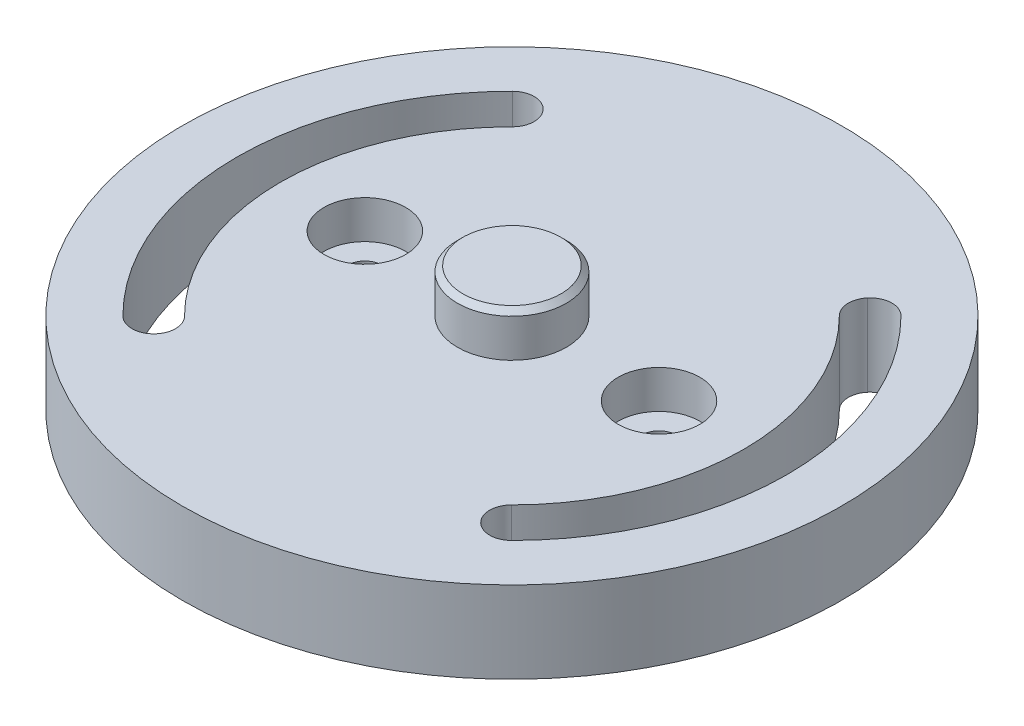
from build123d import *

# Parameters (mm, degrees)
SKETCH1_R           = 60.5
SKETCH1_R_2         = 50.5
SKETCH1_R_3         = 42.5
BOSS_EXTRUDE1_DEPTH = 15
SKETCH2_R           = 7.5
CUT_EXTRUDE1_DEPTH  = 7
SKETCH3_R           = 3.15
CUT_EXTRUDE2_DEPTH  = 15
FILLET1_R           = 4
SKETCH4_R           = 10
BOSS_EXTRUDE2_DEPTH = 8
CHAMFER1_SIZE       = 1


with BuildPart() as part:
    # Sketch1 → Boss-Extrude1 (new body)
    # profile 1 of 4: a face of its own
    with BuildSketch(Plane(origin=(0, 0, 0), x_dir=(1, 0, 0), z_dir=(0, 1, 0))):
        with Locations(Location((0, 0, 0), (0, 0, 270))):
            Circle(SKETCH1_R)
        Circle(SKETCH1_R_2, mode=Mode.SUBTRACT)
    # profile 2 of 4: a face of its own
    with BuildSketch(Plane(origin=(0, 0, 0), x_dir=(1, 0, 0), z_dir=(0, 1, 0))):
        with BuildLine():
            ThreePointArc((-27.318473412, 32.556888833), (0, 42.5), (27.318473412, 32.556888833))
            Line((27.318473412, 32.556888833), (32.460774289, 38.685244378))
            ThreePointArc((32.460774289, 38.685244378), (0, 50.5), (-32.460774289, 38.685244378))
            Line((-32.460774289, 38.685244378), (-27.318473412, 32.556888833))
        make_face()
    # profile 3 of 4: a face of its own
    with BuildSketch(Plane(origin=(0, 0, 0), x_dir=(1, 0, 0), z_dir=(0, 1, 0))):
        Circle(SKETCH1_R_3)
    # profile 4 of 4: a face of its own
    with BuildSketch(Plane(origin=(0, 0, 0), x_dir=(1, 0, 0), z_dir=(0, 1, 0))):
        with BuildLine():
            Line((32.460774289, -38.685244378), (27.318473412, -32.556888833))
            ThreePointArc((27.318473412, -32.556888833), (0, -42.5), (-27.318473412, -32.556888833))
            Line((-27.318473412, -32.556888833), (-32.460774289, -38.685244378))
            ThreePointArc((-32.460774289, -38.685244378), (0, -50.5), (32.460774289, -38.685244378))
        make_face()
    extrude(amount=BOSS_EXTRUDE1_DEPTH)

    # Sketch2 → Cut-Extrude1 (cut)
    with BuildSketch(Plane(origin=(0, 15, 0), x_dir=(1, 0, 0), z_dir=(0, 1, 0))):
        with Locations(Location((-27, 0, 0), (0, 0, 270))):
            Circle(SKETCH2_R)
        with Locations(Location((27, 0, 0), (0, 0, 270))):
            Circle(SKETCH2_R)
    extrude(amount=-CUT_EXTRUDE1_DEPTH, mode=Mode.SUBTRACT)

    # Sketch3 → Cut-Extrude2 (cut)
    with BuildSketch(Plane(origin=(0, 15, 0), x_dir=(1, 0, 0), z_dir=(0, 1, 0))):
        with Locations(Location((-27, 0, 0), (0, 0, 270))):
            Circle(SKETCH3_R)
        with Locations(Location((27, 0, 0), (0, 0, 270))):
            Circle(SKETCH3_R)
    extrude(amount=-CUT_EXTRUDE2_DEPTH, mode=Mode.SUBTRACT)

    # Fillet1
    fillet1_edges = [part.edges().sort_by_distance(p)[0] for p in [
        (32.460774289, 7.5, 38.685244378),
        (27.318473412, 7.5, 32.556888833),
        (-27.318473412, 7.5, 32.556888833),
        (-32.460774289, 7.5, 38.685244378),
        (32.460774289, 7.5, -38.685244378),
        (27.318473412, 7.5, -32.556888833),
        (-27.318473412, 7.5, -32.556888833),
        (-32.460774289, 7.5, -38.685244378),
    ]]
    fillet(fillet1_edges, radius=FILLET1_R - 0.0001)  # a hair under: the kernel refuses the full size

    # Sketch4 → Boss-Extrude2 (add)
    with BuildSketch(Plane(origin=(0, 15, 0), x_dir=(1, 0, 0), z_dir=(0, 1, 0))):
        with Locations(Location((0, 0, 0), (0, 0, 270))):
            Circle(SKETCH4_R)
    extrude(amount=BOSS_EXTRUDE2_DEPTH)

    # Chamfer1
    chamfer1_edges = [part.edges().sort_by_distance(p)[0] for p in [
        (0, 23, -10),
    ]]
    chamfer(chamfer1_edges, length=CHAMFER1_SIZE)


solid = part.part
